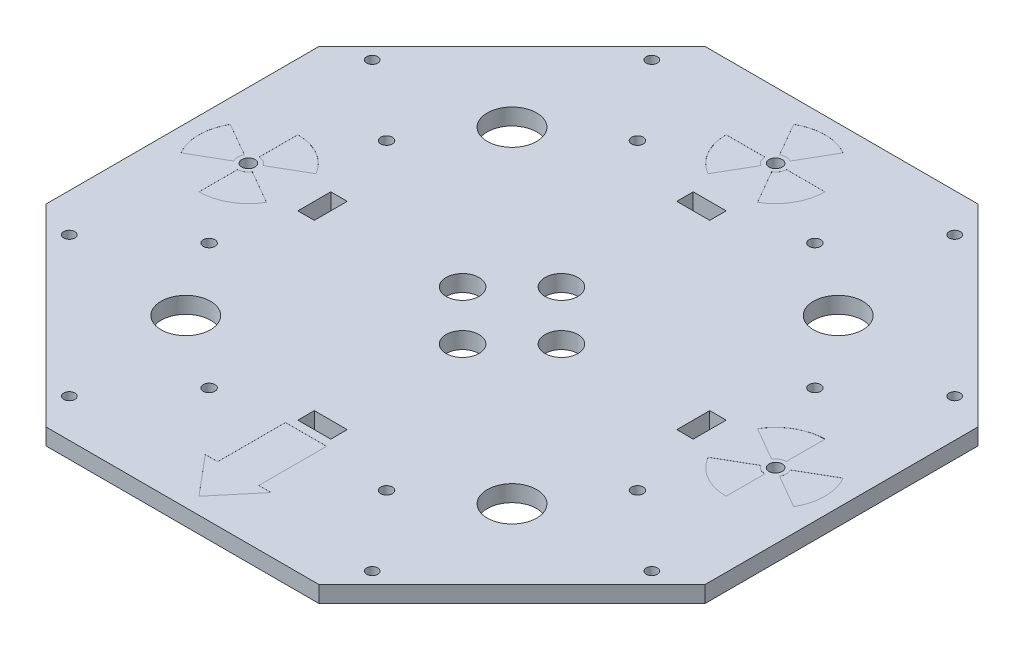
from build123d import *

# Parameters (mm, degrees)
BASE_DEPTH                      = 6.35
SUPPORT_CUTOUTS_REACH           = 181.717
SKETCH4_W                       = 12.7
SKETCH4_H                       = 6.35
SUPPORT_CUTOUT_PATTERN_COUNT    = 4
F_8_CLEARANCE_HOLE1_D           = 4.4958
CABLE_HOLES_REACH               = 181.717
SKETCH14_R                      = 9.525
PLATE_MOUNTING_HOLES_D          = 4.3053
CIRPATTERN1_COUNT               = 4
SKETCH21_R                      = 6.35
CUT_EXTRUDE1_DEPTH              = 180.717340566
CIRPATTERN2_COUNT               = 4
ARROW_DEPTH                     = 0.0254
SKETCH23_R                      = 2.54
RADIATION_SYMBOL_DEPTH          = 0.0254
SKETCH25_R                      = 2.54
RADIATION_SYMBOL_LED_HOLE_DEPTH = 180.717340566
CIRPATTERN3_COUNT               = 3
CIRPATTERN3_ANGLE               = 180


with BuildPart() as part:
    # Base sketch → Base (new body)
    with BuildSketch(Plane(origin=(0, 0, 0), x_dir=(1, 0, 0), z_dir=(0, 1, 0))):
        Polygon((-127, 52.605122421), (-127, -52.605122421), (-52.605122421, -127), (52.605122421, -127), (127, -52.605122421), (127, 52.605122421), (52.605122421, 127), (-52.605122421, 127), align=None)
    extrude(amount=BASE_DEPTH)

    # Sketch4 → Support cutouts (cut, up to next)
    with BuildSketch(Plane(origin=(0, 6.35, 0), x_dir=(1, 0, 0), z_dir=(0, 1, 0)), mode=Mode.PRIVATE) as support_cutouts_sk1:
        with Locations((0, 73.025)):
            Rectangle(SKETCH4_W, SKETCH4_H)
    support_cutouts_tool1 = extrude(support_cutouts_sk1.sketch, amount=-SUPPORT_CUTOUTS_REACH, mode=Mode.PRIVATE) & part.part
    support_cutouts = support_cutouts_tool1.solids().sort_by_distance((0, 6.35, -73.025))[0]
    add(support_cutouts, mode=Mode.SUBTRACT)

    # Support cutout pattern: Support cutouts ×4 about axis
    support_cutout_pattern_axis = Axis((0, -0.29972, 0), (0, 1, 0))
    for i in range(1, SUPPORT_CUTOUT_PATTERN_COUNT):
        add(support_cutouts.rotate(support_cutout_pattern_axis, i * 360 / SUPPORT_CUTOUT_PATTERN_COUNT), mode=Mode.SUBTRACT)

    # #8 Clearance Hole1 (through all)
    with Locations(Plane(origin=(0, 6.35, 0), x_dir=(1, 0, 0), z_dir=(0, 1, 0))):
        with Locations((-82.55, 34.193329574), (-34.193329574, 82.55), (34.193329574, 82.55), (82.55, 34.193329574), (82.55, -34.193329574), (34.193329574, -82.55), (-34.193329574, -82.55), (-82.55, -34.193329574)):
            Hole(F_8_CLEARANCE_HOLE1_D / 2)

    # Sketch14 → Cable holes (cut, up to next)
    with BuildSketch(Plane(origin=(0, 6.35, 0), x_dir=(1, 0, 0), z_dir=(0, 1, 0)), mode=Mode.PRIVATE) as cable_holes_sk1:
        with Locations((-62.861792847, 62.861792847)):
            Circle(SKETCH14_R)
    cable_holes_tool1 = extrude(cable_holes_sk1.sketch, amount=-CABLE_HOLES_REACH, mode=Mode.PRIVATE) & part.part
    # Sketch14 → Cable holes (cut, up to next)
    with BuildSketch(Plane(origin=(0, 6.35, 0), x_dir=(1, 0, 0), z_dir=(0, 1, 0)), mode=Mode.PRIVATE) as cable_holes_sk2:
        with Locations((62.861792847, 62.861792847)):
            Circle(SKETCH14_R)
    cable_holes_tool2 = extrude(cable_holes_sk2.sketch, amount=-CABLE_HOLES_REACH, mode=Mode.PRIVATE) & part.part
    # Sketch14 → Cable holes (cut, up to next)
    with BuildSketch(Plane(origin=(0, 6.35, 0), x_dir=(1, 0, 0), z_dir=(0, 1, 0)), mode=Mode.PRIVATE) as cable_holes_sk3:
        with Locations((62.861792847, -62.861792847)):
            Circle(SKETCH14_R)
    cable_holes_tool3 = extrude(cable_holes_sk3.sketch, amount=-CABLE_HOLES_REACH, mode=Mode.PRIVATE) & part.part
    # Sketch14 → Cable holes (cut, up to next)
    with BuildSketch(Plane(origin=(0, 6.35, 0), x_dir=(1, 0, 0), z_dir=(0, 1, 0)), mode=Mode.PRIVATE) as cable_holes_sk4:
        with Locations((-62.861792847, -62.861792847)):
            Circle(SKETCH14_R)
    cable_holes_tool4 = extrude(cable_holes_sk4.sketch, amount=-CABLE_HOLES_REACH, mode=Mode.PRIVATE) & part.part
    add(cable_holes_tool1.solids().sort_by_distance((-62.861793, 6.35, -62.861793))[0], mode=Mode.SUBTRACT)
    add(cable_holes_tool2.solids().sort_by_distance((62.861793, 6.35, -62.861793))[0], mode=Mode.SUBTRACT)
    add(cable_holes_tool3.solids().sort_by_distance((62.861793, 6.35, 62.861793))[0], mode=Mode.SUBTRACT)
    add(cable_holes_tool4.solids().sort_by_distance((-62.861793, 6.35, 62.861793))[0], mode=Mode.SUBTRACT)

    # plate mounting holes (through all)
    with Locations(Plane(origin=(0, 6.35, 0), x_dir=(1, 0, 0), z_dir=(0, 1, 0))):
        with Locations((112.253201513, 58.371664787), (58.371664787, 112.253201513)):
            plate_mounting_holes = Hole(PLATE_MOUNTING_HOLES_D / 2)

    # CirPattern1: plate mounting holes ×4 about axis
    cirpattern1_axis = Axis((0, -0.29972, 0), (0, 1, 0))
    for i in range(1, CIRPATTERN1_COUNT):
        add(plate_mounting_holes.rotate(cirpattern1_axis, i * 360 / CIRPATTERN1_COUNT), mode=Mode.SUBTRACT)

    # Sketch21 → Cut-Extrude1 (cut, through all)
    with BuildSketch(Plane(origin=(0, 6.35, 0), x_dir=(1, 0, 0), z_dir=(0, 1, 0))):
        with Locations((0, 19.05)):
            Circle(SKETCH21_R)
    cut_extrude1 = extrude(amount=-CUT_EXTRUDE1_DEPTH, mode=Mode.SUBTRACT)

    # CirPattern2: Cut-Extrude1 ×4 about axis
    cirpattern2_axis = Axis((0, -0.29972, 0), (0, 1, 0))
    for i in range(1, CIRPATTERN2_COUNT):
        add(cut_extrude1.rotate(cirpattern2_axis, i * 360 / CIRPATTERN2_COUNT), mode=Mode.SUBTRACT)

    # Sketch22 → Arrow (cut)
    with BuildSketch(Plane(origin=(0, 6.35, 0), x_dir=(1, 0, 0), z_dir=(0, 1, 0))):
        Polygon((0, -120.65), (-12.7, -105.514729374), (-7.9375, -105.514729374), (-7.9375, -79.375), (7.9375, -79.375), (7.9375, -105.514729374), (12.7, -105.514729374), align=None)
    extrude(amount=-ARROW_DEPTH, mode=Mode.SUBTRACT)

    # Sketch23 → Radiation symbol (cut)
    with BuildSketch(Plane(origin=(0, 6.35, 0), x_dir=(1, 0, 0), z_dir=(0, 1, 0))):
        with Locations((101.6, 0)):
            Circle(SKETCH23_R)
        with BuildLine():
            Line((105.174519854, -2.06375), (118.097783942, -9.525))
            ThreePointArc((118.097783942, -9.525), (120.65, 0), (118.097783942, 9.525))
            Line((118.097783942, 9.525), (105.174519854, 2.06375))
            ThreePointArc((105.174519854, 2.06375), (105.7275, 0), (105.174519854, -2.06375))
        make_face()
        with BuildLine():
            Line((98.025480146, -2.06375), (85.102216058, -9.525))
            ThreePointArc((85.102216058, -9.525), (92.075, -16.497783942), (101.6, -19.05))
            Line((101.6, -19.05), (101.6, -4.1275))
            ThreePointArc((101.6, -4.1275), (99.53625, -3.574519854), (98.025480146, -2.06375))
        make_face()
        with BuildLine():
            Line((98.025480146, 2.06375), (85.102216058, 9.525))
            ThreePointArc((85.102216058, 9.525), (92.075, 16.497783942), (101.6, 19.05))
            Line((101.6, 19.05), (101.6, 4.1275))
            ThreePointArc((101.6, 4.1275), (99.53625, 3.574519854), (98.025480146, 2.06375))
        make_face()
    radiation_symbol = extrude(amount=-RADIATION_SYMBOL_DEPTH, mode=Mode.SUBTRACT)

    # Sketch25 → Radiation symbol LED hole (cut, through all)
    with BuildSketch(Plane(origin=(0, 6.35, 0), x_dir=(1, 0, 0), z_dir=(0, 1, 0))):
        with Locations((101.6, 0)):
            Circle(SKETCH25_R)
    radiation_symbol_led_hole = extrude(amount=-RADIATION_SYMBOL_LED_HOLE_DEPTH, mode=Mode.SUBTRACT)

    # CirPattern3: Radiation symbol, Radiation symbol LED hole ×3 about axis
    cirpattern3_axis = Axis((0, -0.29972, 0), (0, 1, 0))
    add([radiation_symbol.rotate(cirpattern3_axis, i * CIRPATTERN3_ANGLE / (CIRPATTERN3_COUNT - 1)) for i in range(1, CIRPATTERN3_COUNT)], mode=Mode.SUBTRACT)
    add([radiation_symbol_led_hole.rotate(cirpattern3_axis, i * CIRPATTERN3_ANGLE / (CIRPATTERN3_COUNT - 1)) for i in range(1, CIRPATTERN3_COUNT)], mode=Mode.SUBTRACT)


solid = part.part
